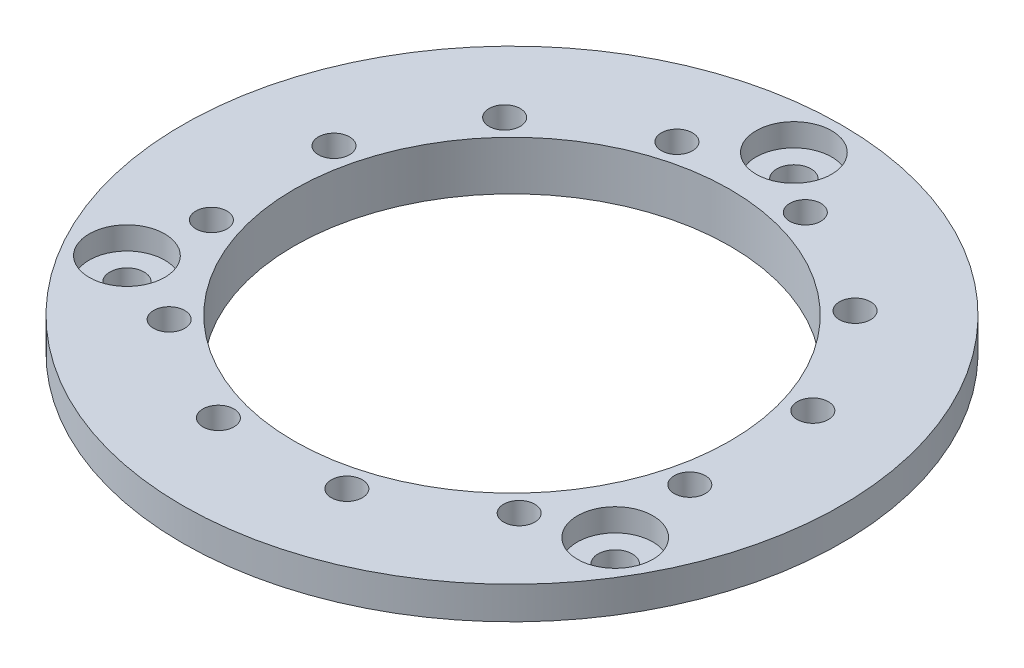
from build123d import *

# Parameters (mm, degrees)
SKETCH2_R                               = 63.5
SKETCH2_R_2                             = 42.0000049
BOSS_EXTRUDE1_DEPTH                     = 9.449999896
CBORE_FOR_M6_HEX_HEAD_BOLT4_D           = 6.6
CBORE_FOR_M6_HEX_HEAD_BOLT4_DEPTH       = 19.75
CBORE_FOR_M6_HEX_HEAD_BOLT4_CBORE_D     = 14.55
CBORE_FOR_M6_HEX_HEAD_BOLT4_CBORE_DEPTH = 4.38
CBORE_FOR_M6_HEX_HEAD_BOLT4_TIP         = 1.982840043
M7X1_0_TAPPED_HOLE3_D                   = 6
M7X1_0_TAPPED_HOLE3_DEPTH               = 16.9999914
M7X1_0_TAPPED_HOLE3_TIP                 = 1.802581857
SKETCH27_W                              = 4.908836101
SKETCH27_H                              = 3.175


with BuildPart() as part:
    # Sketch2 → Boss-Extrude1 (new body)
    with BuildSketch(Plane(origin=(0, 0, 0), x_dir=(1, 0, 0), z_dir=(0, 1, 0))):
        Circle(SKETCH2_R)
        Circle(SKETCH2_R_2, mode=Mode.SUBTRACT)
    extrude(amount=BOSS_EXTRUDE1_DEPTH)

    # CBORE for M6 Hex Head Bolt4
    with Locations(Plane(origin=(0, 9.449999896, -54.312489002), x_dir=(0, 0, 1), z_dir=(0, 1, 0))):
        with Locations((0, 0), (81.468733503, 47.035995218), (81.468733503, -47.035995218)):
            CounterBoreHole(CBORE_FOR_M6_HEX_HEAD_BOLT4_D / 2, CBORE_FOR_M6_HEX_HEAD_BOLT4_CBORE_D / 2, CBORE_FOR_M6_HEX_HEAD_BOLT4_CBORE_DEPTH, depth=CBORE_FOR_M6_HEX_HEAD_BOLT4_DEPTH)
            with Locations((0, 0, -(CBORE_FOR_M6_HEX_HEAD_BOLT4_DEPTH + CBORE_FOR_M6_HEX_HEAD_BOLT4_TIP / 2))):  # 118° drill point
                Cone(0, CBORE_FOR_M6_HEX_HEAD_BOLT4_D / 2, CBORE_FOR_M6_HEX_HEAD_BOLT4_TIP, mode=Mode.SUBTRACT)

    # M7x1.0 Tapped Hole3
    with Locations(Plane(origin=(-13.0465884, 0, -44.825552067), x_dir=(0, 0, -1), z_dir=(0, -1, 0))):
        with Locations((0, 0), (-12.539586356, -20.660394089), (-33.712965853, -32.370005754), (-57.89219729, -31.805785952), (-78.55835606, -19.284894855), (-90.249809996, 1.901476787), (-89.698224446, 26.096379464), (-77.167136483, 46.771746694), (-55.96926421, 58.447428045), (-31.76599188, 57.950892095), (-11.031420511, 45.349628337), (0.603153584, 24.136310715)):
            Hole(M7X1_0_TAPPED_HOLE3_D / 2, depth=M7X1_0_TAPPED_HOLE3_DEPTH)
            with Locations((0, 0, -(M7X1_0_TAPPED_HOLE3_DEPTH + M7X1_0_TAPPED_HOLE3_TIP / 2))):  # 118° drill point
                Cone(0, M7X1_0_TAPPED_HOLE3_D / 2, M7X1_0_TAPPED_HOLE3_TIP, mode=Mode.SUBTRACT)

    # Sketch27 → Cut-Revolve1 (revolve, cut)
    with BuildSketch(Plane.XY):
        with Locations((61.04558195, 1.5875)):
            Rectangle(SKETCH27_W, SKETCH27_H)
    revolve(axis=Axis((0, 0, 0), (0, 1, 0)), mode=Mode.SUBTRACT)


solid = part.part
